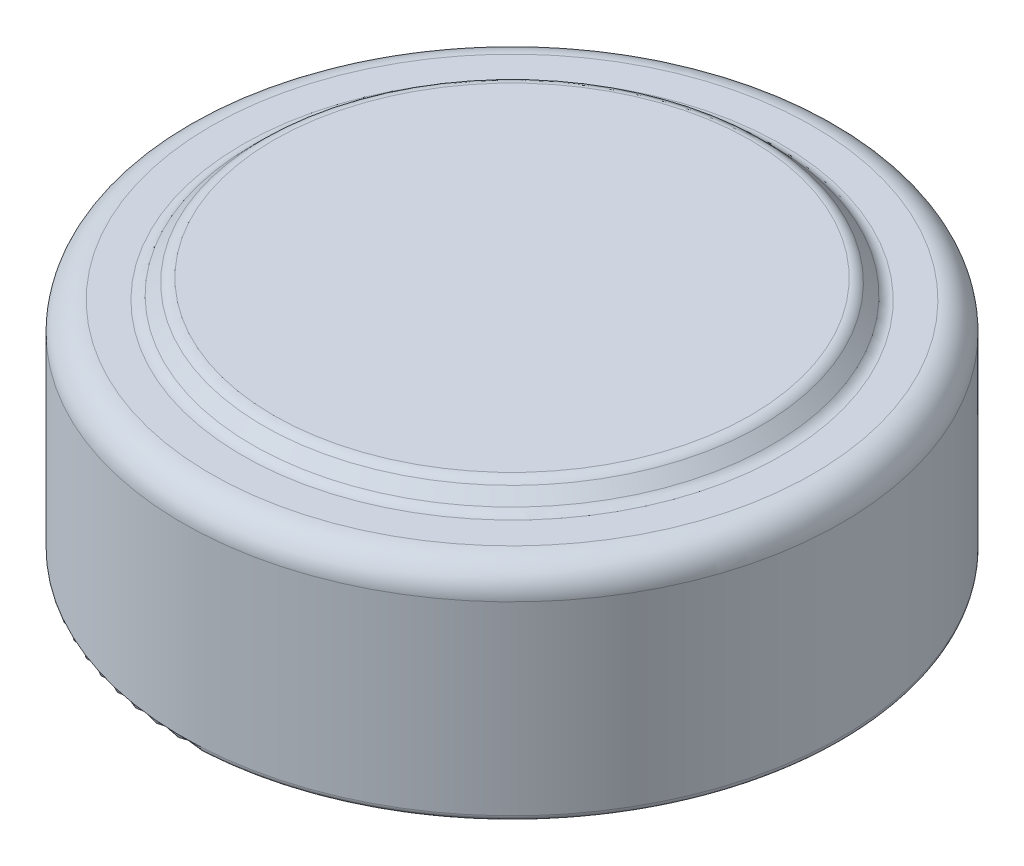
from build123d import *


with BuildPart() as part:
    # Sketch1 → Revolve1 (revolve)
    with BuildSketch(Plane.XY):
        with BuildLine():
            Line((0, 0), (-5.7, 0))
            ThreePointArc((-5.7, 0), (-5.770710678, 0.029289322), (-5.8, 0.1))
            Line((-5.8, 0.1), (-5.8, 3.36))
            ThreePointArc((-5.8, 3.36), (-5.653553391, 3.713553391), (-5.3, 3.86))
            Line((-5.3, 3.86), (-4.743553391, 3.86))
            ThreePointArc((-4.743553391, 3.86), (-4.647882533, 3.879030117), (-4.566776695, 3.933223305))
            Line((-4.566776695, 3.933223305), (-4.373223305, 4.126776695))
            ThreePointArc((-4.373223305, 4.126776695), (-4.292117467, 4.180969883), (-4.196446609, 4.2))
            Line((-4.196446609, 4.2), (0, 4.2))
            Line((0, 4.2), (0, 0))
        make_face()
    revolve(axis=Axis((0, 4.2, 0), (0, -1, 0)))


solid = part.part
